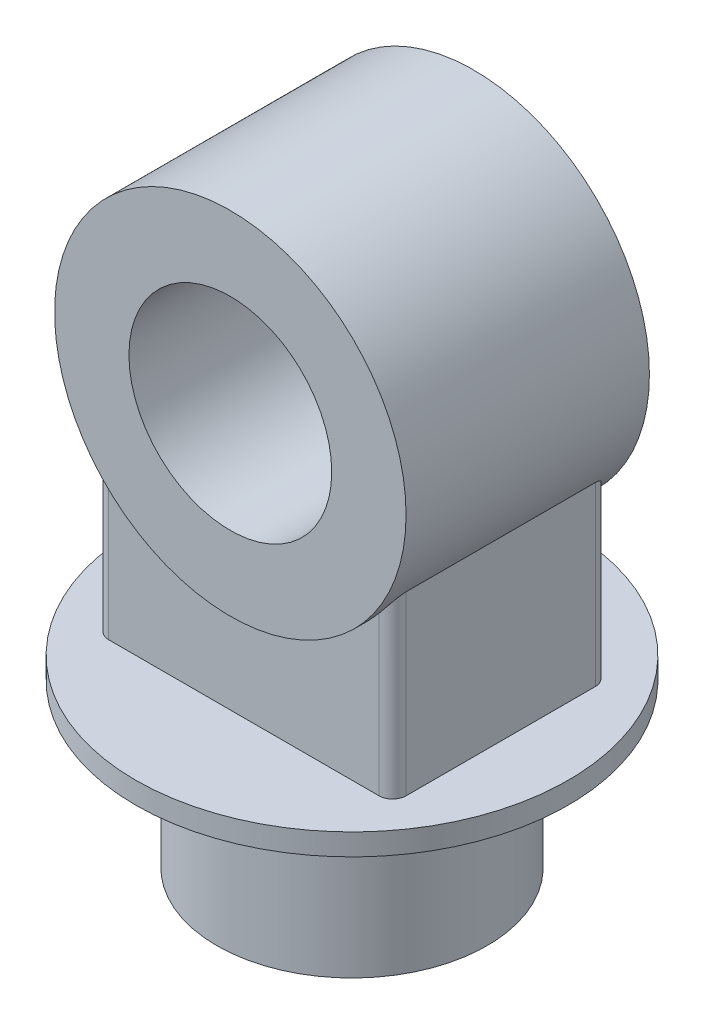
from build123d import *

# Parameters (mm, degrees)
SKETCH1_R           = 100
BOSS_EXTRUDE1_DEPTH = 120
SKETCH2_R           = 160
BOSS_EXTRUDE2_DEPTH = 16
SKETCH3_R           = 130
SKETCH3_R_2         = 75
BOSS_EXTRUDE3_DEPTH = 90
BOSS_EXTRUDE4_REACH = 402.125
SKETCH4_W           = 220
SKETCH4_H           = 160
FILLET1_R           = 10


with BuildPart() as part:
    # Sketch1 → Boss-Extrude1 (new body)
    with BuildSketch(Plane(origin=(0, 0, 0), x_dir=(1, 0, 0), z_dir=(0, 1, 0))):
        Circle(SKETCH1_R)
    extrude(amount=BOSS_EXTRUDE1_DEPTH)

    # Sketch2 → Boss-Extrude2 (add)
    with BuildSketch(Plane(origin=(0, 120, 0), x_dir=(1, 0, 0), z_dir=(0, 1, 0))):
        Circle(SKETCH2_R)
    extrude(amount=BOSS_EXTRUDE2_DEPTH)


with BuildPart() as body_2:
    # Sketch3 → Boss-Extrude3 (new, symmetric)
    with BuildSketch(Plane.XY):
        with Locations((0, 336)):
            Circle(SKETCH3_R)
        with Locations((0, 336)):
            Circle(SKETCH3_R_2, mode=Mode.SUBTRACT)
    extrude(amount=BOSS_EXTRUDE3_DEPTH, both=True)

    # Sketch4 → Boss-Extrude4 (add, up to next)
    with BuildSketch(Plane(origin=(0, 136, 0), x_dir=(1, 0, 0), z_dir=(0, 1, 0)), mode=Mode.PRIVATE) as boss_extrude4_sk1:
        Rectangle(SKETCH4_W, SKETCH4_H)
    boss_extrude4_tool1 = extrude(boss_extrude4_sk1.sketch, amount=BOSS_EXTRUDE4_REACH, mode=Mode.PRIVATE) - body_2.part

    add(part.part)  # Boss-Extrude4 merges part
    add(boss_extrude4_tool1.solids().sort_by_distance((0, 136, 0))[0])

    # Fillet1
    fillet1_edges = [body_2.edges().sort_by_distance(p)[0] for p in [
        (-110, 201.358983849, 80),
        (-110, 201.358983849, -80),
        (110, 201.358983849, -80),
        (110, 201.358983849, 80),
    ]]
    fillet(fillet1_edges, radius=FILLET1_R)


solid = body_2.part
